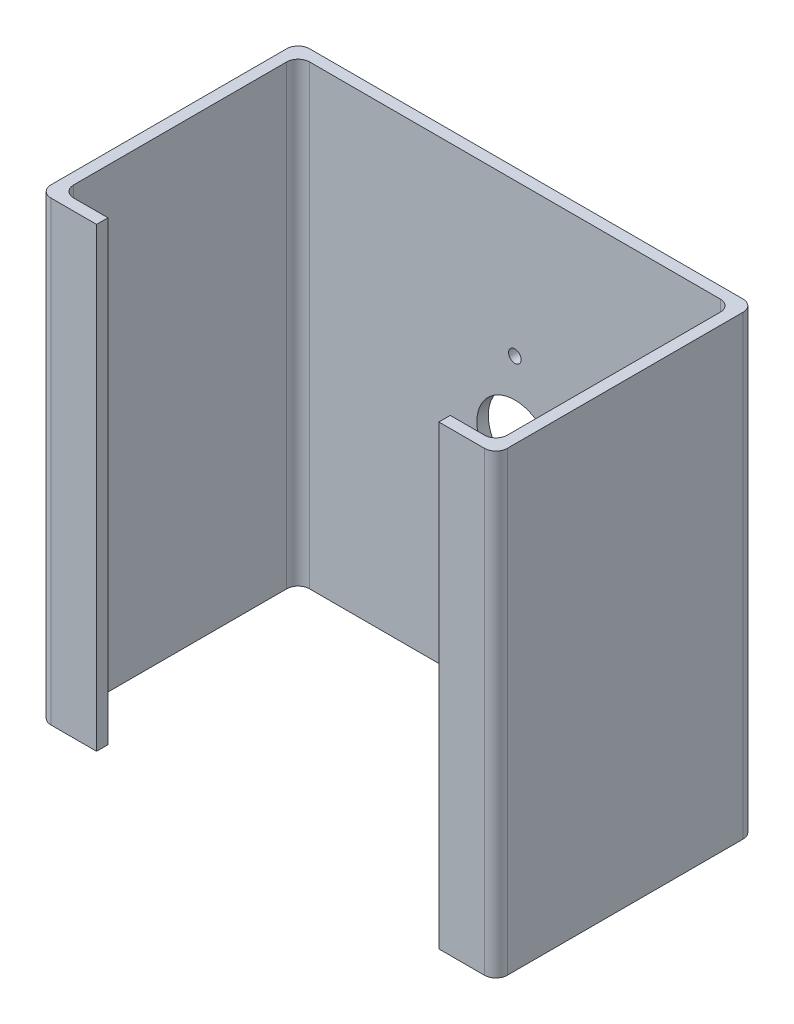
from build123d import *

# Parameters (mm, degrees)
SM_BASE_FLANGE_1_DEPTH = 120
SKETCH_6_R             = 10
SKETCH_6_R_2           = 1.65
CUT_EXTRUDE_1_DEPTH    = 10
FILLET_1_R             = 3


# Sheet-metal steps are written as plain solids
with BuildPart() as part:
    # Sketch 1 → 基体-法兰1 (new body)
    with BuildSketch(Plane(origin=(0, 0, 0), x_dir=(1, 0, 0), z_dir=(0, 1, 0))):
        Polygon((0, 0), (-12, 0), (-12, 62), (102, 62), (102, 0), (90, 0), (90, -3), (105, -3), (105, 65), (-15, 65), (-15, -3), (0, -3), align=None)
    extrude(amount=-SM_BASE_FLANGE_1_DEPTH)

    # 草图6 → 切除-拉伸1 (cut)
    with BuildSketch(Plane(origin=(0, 0, -65), x_dir=(-1, 0, 0), z_dir=(0, 0, -1))):
        with Locations((-45, -60)):
            Circle(SKETCH_6_R)
        with Locations((-62.320508076, -70)):
            Circle(SKETCH_6_R_2)
        with Locations((-45, -40)):
            Circle(SKETCH_6_R_2)
        with Locations((-27.679491924, -70)):
            Circle(SKETCH_6_R_2)
    extrude(amount=-CUT_EXTRUDE_1_DEPTH, mode=Mode.SUBTRACT)

    # 圆角1
    fillet_1_edges = [part.edges().sort_by_distance(p)[0] for p in [
        (-15, -60, 3),
        (-15, -60, -65),
        (105, -60, -65),
        (105, -60, 3),
        (102, -60, 0),
        (102, -60, -62),
        (-12, -60, -62),
        (-12, -60, 0),
    ]]
    fillet(fillet_1_edges, radius=FILLET_1_R)


solid = part.part
